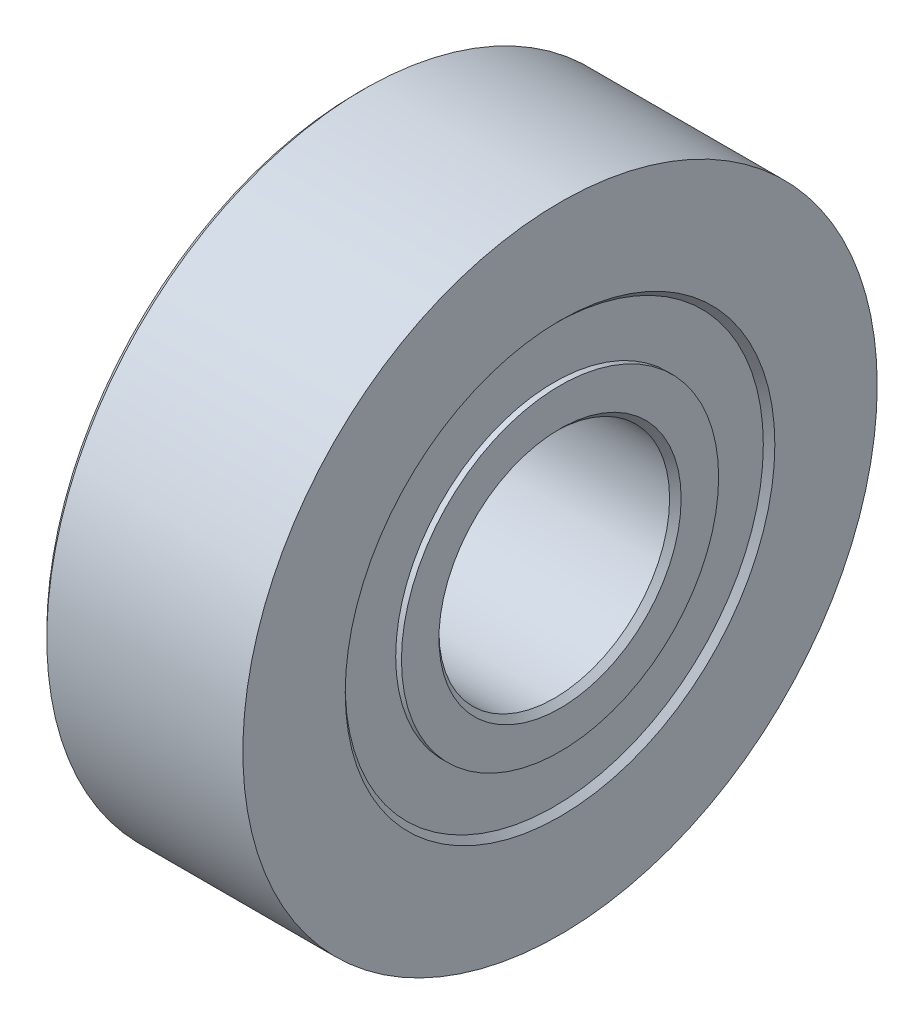
from build123d import *

# Parameters (mm, degrees)
SKETCH2_R           = 11
BOSS_EXTRUDE1_DEPTH = 3.5
SKETCH3_R           = 4
CUT_EXTRUDE1_DEPTH  = 18.058722109
SKETCH4_R           = 7.25
SKETCH4_R_2         = 5.5
CUT_EXTRUDE2_DEPTH  = 0.2
CHAMFER1_SIZE       = 0.2


with BuildPart() as part:
    # Sketch2 → Boss-Extrude1 (new, symmetric)
    with BuildSketch(Plane(origin=(0, 0, 0), x_dir=(0, 0, -1), z_dir=(1, 0, 0))):
        Circle(SKETCH2_R)
    extrude(amount=BOSS_EXTRUDE1_DEPTH, both=True)

    # Sketch3 → Cut-Extrude1 (cut, through all)
    with BuildSketch(Plane(origin=(3.5, 0, 0), x_dir=(0, 0, -1), z_dir=(1, 0, 0))):
        Circle(SKETCH3_R)
    extrude(amount=-CUT_EXTRUDE1_DEPTH, mode=Mode.SUBTRACT)

    # Sketch4 → Cut-Extrude2 (cut)
    with BuildSketch(Plane(origin=(3.5, 0, 0), x_dir=(0, 0, -1), z_dir=(1, 0, 0))):
        Circle(SKETCH4_R)
        Circle(SKETCH4_R_2, mode=Mode.SUBTRACT)
    cut_extrude2 = extrude(amount=-CUT_EXTRUDE2_DEPTH, mode=Mode.SUBTRACT)

    # Mirror1: Cut-Extrude2 across plane
    add(cut_extrude2.mirror(Plane(origin=(0, 0, 0), x_dir=(0, 0, 1), z_dir=(1, 0, 0))), mode=Mode.SUBTRACT)

    # Chamfer1
    chamfer1_edges = [part.edges().sort_by_distance(p)[0] for p in [
        (3.5, 0, 7.25),
        (-3.5, 0, 11),
        (-3.5, 0, 4),
        (3.5, 0, 4),
    ]]
    chamfer(chamfer1_edges, length=CHAMFER1_SIZE - 0.0001)  # a hair under: the kernel refuses the full size


solid = part.part
